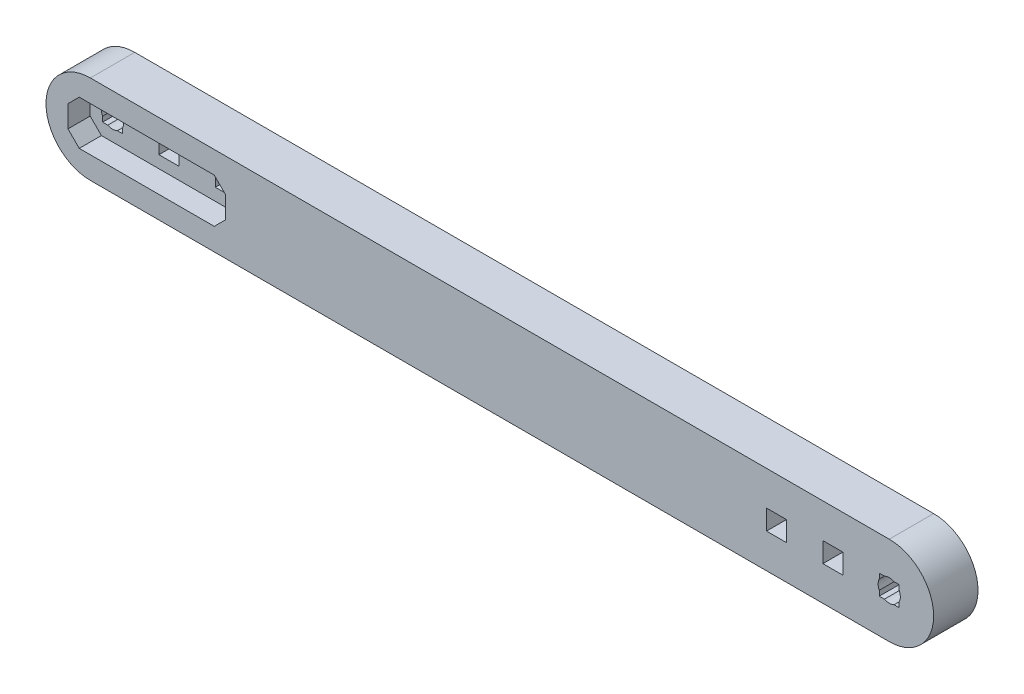
from build123d import *

# Parameters (mm, degrees)
SKETCH1_R           = 2.5
BOSS_EXTRUDE1_DEPTH = 10
CUT_EXTRUDE1_START  = -10
SKETCH2_R           = 2.5
SKETCH2_W           = 4.5
SKETCH2_H           = 4.5
CUT_EXTRUDE1_DEPTH  = 10
CUT_EXTRUDE2_START  = -5
SKETCH2_3_W         = 4.5
SKETCH2_3_H         = 4.5
CUT_EXTRUDE2_DEPTH  = 5
SKETCH3_R           = 2.5
SKETCH3_W           = 4.5
SKETCH3_H           = 4.5
CUT_EXTRUDE3_DEPTH  = 10
SKETCH3_3_W         = 4.5
SKETCH3_3_H         = 4.5
CUT_EXTRUDE4_DEPTH  = 5


with BuildPart() as part:
    # Sketch1 → Boss-Extrude1 (new body)
    with BuildSketch(Plane.XY):
        with BuildLine():
            Line((0, 10), (180, 10))
            ThreePointArc((180, 10), (190, 0), (180, -10))
            Line((180, -10), (0, -10))
            ThreePointArc((0, -10), (-10, 0), (0, 10))
        make_face()
        Circle(SKETCH1_R, mode=Mode.SUBTRACT)
        with Locations((180, 0)):
            Circle(SKETCH1_R, mode=Mode.SUBTRACT)
    extrude(amount=BOSS_EXTRUDE1_DEPTH)

    # Sketch2 → Cut-Extrude1 (cut)
    with BuildSketch(Plane.XY.offset(10).offset(CUT_EXTRUDE1_START)):
        Circle(SKETCH2_R)
        with Locations((25.4, 0)):
            Rectangle(SKETCH2_W, SKETCH2_H)
        with Locations((12.7, 0)):
            Rectangle(SKETCH2_W, SKETCH2_H)
        Rectangle(SKETCH2_W, SKETCH2_H)
    extrude(amount=CUT_EXTRUDE1_DEPTH, mode=Mode.SUBTRACT)

    # Sketch2<3> → Cut-Extrude2 (cut)
    with BuildSketch(Plane.XY.offset(10).offset(CUT_EXTRUDE2_START)):
        Polygon((-2.51, -5), (27.91, -5), (30.45, -2.46), (30.45, 2.46), (27.91, 5), (-2.51, 5), (-5.05, 2.46), (-5.05, -2.46), align=None)
        with BuildLine():
            Line((1.089724736, 2.25), (2.25, 2.25))
            Line((2.25, 2.25), (2.25, 1.089724736))
            ThreePointArc((2.25, 1.089724736), (2.436698586, 0.559016994), (2.5, 0))
            ThreePointArc((2.5, 0), (2.436698586, -0.559016994), (2.25, -1.089724736))
            Line((2.25, -1.089724736), (2.25, -2.25))
            Line((2.25, -2.25), (1.089724736, -2.25))
            ThreePointArc((1.089724736, -2.25), (0, -2.5), (-1.089724736, -2.25))
            Line((-1.089724736, -2.25), (-2.25, -2.25))
            Line((-2.25, -2.25), (-2.25, -1.089724736))
            ThreePointArc((-2.25, -1.089724736), (-2.5, 0), (-2.25, 1.089724736))
            Line((-2.25, 1.089724736), (-2.25, 2.25))
            Line((-2.25, 2.25), (-1.089724736, 2.25))
            ThreePointArc((-1.089724736, 2.25), (0, 2.5), (1.089724736, 2.25))
        make_face(mode=Mode.SUBTRACT)
        with Locations((12.7, 0)):
            Rectangle(SKETCH2_3_W, SKETCH2_3_H, mode=Mode.SUBTRACT)
        with Locations((25.4, 0)):
            Rectangle(SKETCH2_3_W, SKETCH2_3_H, mode=Mode.SUBTRACT)
    extrude(amount=CUT_EXTRUDE2_DEPTH, mode=Mode.SUBTRACT)

    # Sketch3 → Cut-Extrude3 (cut)
    with BuildSketch(Plane(origin=(0, 0, 0), x_dir=(-1, 0, 0), z_dir=(0, 0, -1))):
        with Locations((-180, 0)):
            Circle(SKETCH3_R)
        with Locations((-154.6, 0)):
            Rectangle(SKETCH3_W, SKETCH3_H)
        with Locations((-167.3, 0)):
            Rectangle(SKETCH3_W, SKETCH3_H)
        with Locations((-180, 0)):
            Rectangle(SKETCH3_W, SKETCH3_H)
    extrude(amount=-CUT_EXTRUDE3_DEPTH, mode=Mode.SUBTRACT)

    # Sketch3<3> → Cut-Extrude4 (cut)
    with BuildSketch(Plane(origin=(0, 0, 0), x_dir=(-1, 0, 0), z_dir=(0, 0, -1))):
        Polygon((-182.51, -5), (-152.09, -5), (-149.55, -2.46), (-149.55, 2.46), (-152.09, 5), (-182.51, 5), (-185.05, 2.46), (-185.05, -2.46), align=None)
        with Locations((-154.6, 0)):
            Rectangle(SKETCH3_3_W, SKETCH3_3_H, mode=Mode.SUBTRACT)
        with BuildLine():
            Line((-178.910275264, 2.25), (-177.75, 2.25))
            Line((-177.75, 2.25), (-177.75, 1.089724736))
            ThreePointArc((-177.75, 1.089724736), (-177.563301414, 0.559016994), (-177.5, 0))
            ThreePointArc((-177.5, 0), (-177.563301414, -0.559016994), (-177.75, -1.089724736))
            Line((-177.75, -1.089724736), (-177.75, -2.25))
            Line((-177.75, -2.25), (-178.910275264, -2.25))
            ThreePointArc((-178.910275264, -2.25), (-180, -2.5), (-181.089724736, -2.25))
            Line((-181.089724736, -2.25), (-182.25, -2.25))
            Line((-182.25, -2.25), (-182.25, -1.089724736))
            ThreePointArc((-182.25, -1.089724736), (-182.5, 0), (-182.25, 1.089724736))
            Line((-182.25, 1.089724736), (-182.25, 2.25))
            Line((-182.25, 2.25), (-181.089724736, 2.25))
            ThreePointArc((-181.089724736, 2.25), (-180, 2.5), (-178.910275264, 2.25))
        make_face(mode=Mode.SUBTRACT)
        with Locations((-167.3, 0)):
            Rectangle(SKETCH3_3_W, SKETCH3_3_H, mode=Mode.SUBTRACT)
    extrude(amount=-CUT_EXTRUDE4_DEPTH, mode=Mode.SUBTRACT)


solid = part.part
